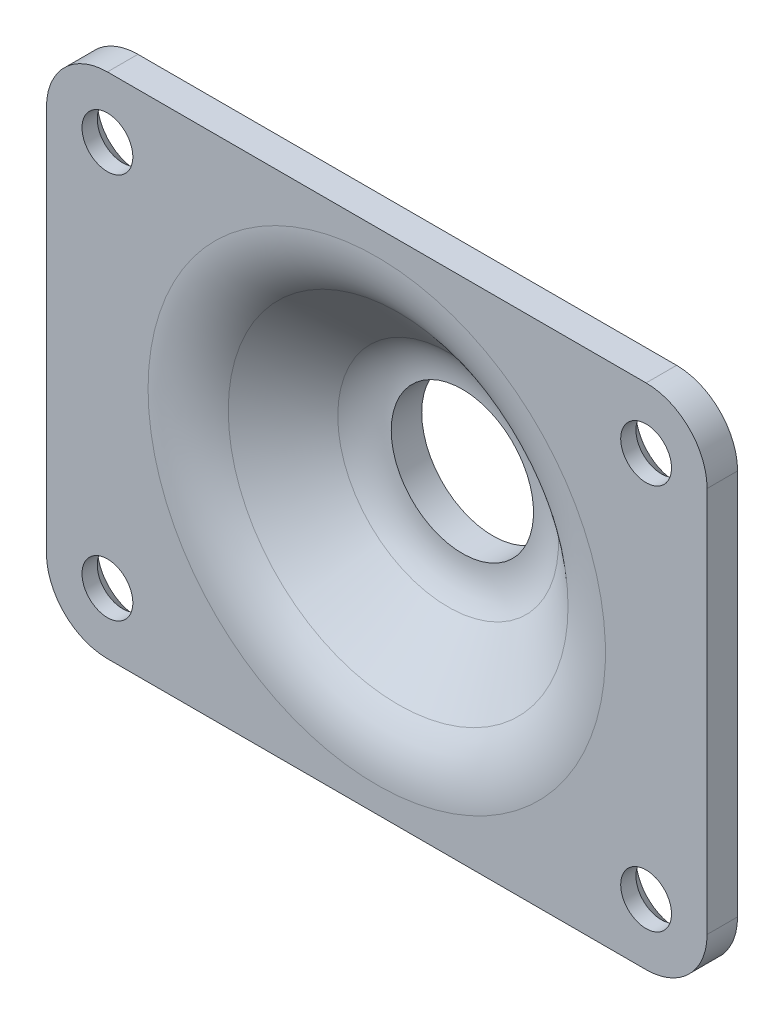
from build123d import *

# Parameters (mm, degrees)
BOSS_EXTRUDE3_START   = -3
SKETCH5_R             = 34.749730026
SKETCH5_R_2           = 22.5
SKETCH5_W             = 65
SKETCH5_H             = 50
BOSS_EXTRUDE3_DEPTH   = 3
SKETCH5_4_OUTSIDE_W   = 91.29
SKETCH5_4_OUTSIDE_H   = 91.29
SKETCH5_4_OUTSIDE_W_2 = 65
SKETCH5_4_OUTSIDE_H_2 = 50
CUT_EXTRUDE2_DEPTH    = 3
CUT_REVOLVE2_START    = 6.924934943
CUT_REVOLVE2_DEPTH    = 3
BOSS_EXTRUDE4_DEPTH   = 3
FILLET1_R             = 6
SKETCH8_R             = 2.5
CUT_EXTRUDE3_DEPTH    = 42.859640811
CHAMFER1_SIZE         = 1.5


with BuildPart() as part:
    # Sketch1 → Revolve1 (revolve)
    with BuildSketch(Plane(origin=(0, 0, 0), x_dir=(1, 0, 0), z_dir=(0, 1, 0)), mode=Mode.PRIVATE) as revolve1_sk:
        with BuildLine():
            Line((22.5, -6.924934943), (32.140333189, -6.924934943))
            Line((32.140333189, -6.924934943), (32.140333189, -9.924934943))
            Line((32.140333189, -9.924934943), (22.5, -9.924934943))
            ThreePointArc((22.5, -9.924934943), (19.42181871, -9.38216853), (16.714911513, -7.819334931))
            Line((16.714911513, -7.819334931), (10.856725658, -2.903733341))
            ThreePointArc((10.856725658, -2.903733341), (9.05212086, -1.861844275), (7, -1.5))
            Line((7, -1.5), (7, 1.5))
            ThreePointArc((7, 1.5), (10.07818129, 0.957233587), (12.785088487, -0.605600012))
            Line((12.785088487, -0.605600012), (18.643274342, -5.521201602))
            ThreePointArc((18.643274342, -5.521201602), (20.44787914, -6.563090668), (22.5, -6.924934943))
        make_face()
        with BuildLine():
            Line((-7, 1.5), (-7, -1.5))
            ThreePointArc((-7, -1.5), (-9.05212086, -1.861844275), (-10.856725658, -2.903733341))
            Line((-10.856725658, -2.903733341), (-16.714911513, -7.819334931))
            ThreePointArc((-16.714911513, -7.819334931), (-19.42181871, -9.38216853), (-22.5, -9.924934943))
            Line((-22.5, -9.924934943), (-34.749730026, -9.924934943))
            Line((-34.749730026, -9.924934943), (-34.749730026, -6.924934943))
            Line((-34.749730026, -6.924934943), (-22.5, -6.924934943))
            ThreePointArc((-22.5, -6.924934943), (-20.44787914, -6.563090668), (-18.643274342, -5.521201602))
            Line((-18.643274342, -5.521201602), (-12.785088487, -0.605600012))
            ThreePointArc((-12.785088487, -0.605600012), (-10.07818129, 0.957233587), (-7, 1.5))
        make_face()
    revolve(revolve1_sk.sketch.rotate(Axis((0, 0, 0), (0, 0, 1)), 180), axis=Axis((0, 0, 0), (0, 0, 1)))

    # Sketch5 → Boss-Extrude3 (add)
    with BuildSketch(Plane.XY.offset(9.924934943).offset(BOSS_EXTRUDE3_START)):
        Circle(SKETCH5_R)
        Circle(SKETCH5_R_2)
        Rectangle(SKETCH5_W, SKETCH5_H)
        Circle(SKETCH5_R_2)
        with BuildLine():
            ThreePointArc((24.135942842, 25), (29.021182623, 19.113207373), (32.5, 12.300151905))
            Line((32.5, 12.300151905), (32.5, 25))
            Line((32.5, 25), (24.135942842, 25))
        make_face()
        with BuildLine():
            ThreePointArc((32.5, -12.300151905), (29.021182623, -19.113207373), (24.135942842, -25))
            Line((24.135942842, -25), (32.5, -25))
            Line((32.5, -25), (32.5, -12.300151905))
        make_face()
        with BuildLine():
            Line((-32.5, -12.300151905), (-32.5, -25))
            Line((-32.5, -25), (-24.135942842, -25))
            ThreePointArc((-24.135942842, -25), (-29.021182623, -19.113207373), (-32.5, -12.300151905))
        make_face()
        with BuildLine():
            Line((-32.5, 25), (-32.5, 12.300151905))
            ThreePointArc((-32.5, 12.300151905), (-29.021182623, 19.113207373), (-24.135942842, 25))
            Line((-24.135942842, 25), (-32.5, 25))
        make_face()
    extrude(amount=BOSS_EXTRUDE3_DEPTH)

    # Sketch5<4> outside → Cut-Extrude2 (cut)
    with BuildSketch(Plane.XY.offset(9.924934943)):
        Rectangle(SKETCH5_4_OUTSIDE_W, SKETCH5_4_OUTSIDE_H)
        Rectangle(SKETCH5_4_OUTSIDE_W_2, SKETCH5_4_OUTSIDE_H_2, mode=Mode.SUBTRACT)
    extrude(amount=-CUT_EXTRUDE2_DEPTH, mode=Mode.SUBTRACT)

    # Cut-Revolve2: read off the stored shape, not the designer's step
    # Cut-Revolve2 outline → Cut-Revolve2 (cut)
    with BuildSketch(Plane.XY.offset(CUT_REVOLVE2_START)):
        with BuildLine():
            Line((32.5, 25), (24.135942842, 25))
            ThreePointArc((24.135942842, 25), (29.021182623, 19.113207373), (32.5, 12.300151905))
            Line((32.5, 12.300151905), (32.5, 25))
        make_face()
        with BuildLine():
            ThreePointArc((-32.5, 12.300151905), (-29.021182623, 19.113207373), (-24.135942842, 25))
            Line((-24.135942842, 25), (-32.5, 25))
            Line((-32.5, 25), (-32.5, 12.300151905))
        make_face()
        with BuildLine():
            Line((32.5, -25), (32.5, -12.300151905))
            ThreePointArc((32.5, -12.300151905), (29.021182623, -19.113207373), (24.135942842, -25))
            Line((24.135942842, -25), (32.5, -25))
        make_face()
        with BuildLine():
            ThreePointArc((-24.135942842, -25), (-29.021182623, -19.113207373), (-32.5, -12.300151905))
            Line((-32.5, -12.300151905), (-32.5, -25))
            Line((-32.5, -25), (-24.135942842, -25))
        make_face()
    extrude(amount=CUT_REVOLVE2_DEPTH, mode=Mode.SUBTRACT)

    # Cut-Revolve2 2 outline → Cut-Revolve2 2 (revolve, cut)
    with BuildSketch(Plane.XZ):
        with BuildLine():
            Line((22.5, 9.924934943), (0, 9.924934943))
            Line((0, 9.924934943), (0, 6.924934943))
            Line((0, 6.924934943), (15.649007114, 6.924934943))
            Line((15.649007114, 6.924934943), (16.714911513, 7.819334931))
            ThreePointArc((16.714911513, 7.819334931), (19.42181871, 9.38216853), (22.5, 9.924934943))
        make_face()
    revolve(axis=Axis((0, 0, 0), (0, 0, 1)), mode=Mode.SUBTRACT)

    # Sketch7 → Boss-Extrude4 (add)
    with BuildSketch(Plane(origin=(0, 0, 6.924934943), x_dir=(-1, 0, 0), z_dir=(0, 0, -1))):
        with BuildLine():
            Line((-32.5, 25), (-32.5, 12.300151905))
            ThreePointArc((-32.5, 12.300151905), (-29.021182623, 19.113207373), (-24.135942842, 25))
            Line((-24.135942842, 25), (-32.5, 25))
        make_face()
        with BuildLine():
            Line((-32.5, -12.300151905), (-32.5, -25))
            Line((-32.5, -25), (-24.135942842, -25))
            ThreePointArc((-24.135942842, -25), (-29.021182623, -19.113207373), (-32.5, -12.300151905))
        make_face()
        with BuildLine():
            ThreePointArc((32.5, -12.300151905), (29.021182623, -19.113207373), (24.135942842, -25))
            Line((24.135942842, -25), (32.5, -25))
            Line((32.5, -25), (32.5, -12.300151905))
        make_face()
        with BuildLine():
            ThreePointArc((24.135942842, 25), (29.021182623, 19.113207373), (32.5, 12.300151905))
            Line((32.5, 12.300151905), (32.5, 25))
            Line((32.5, 25), (24.135942842, 25))
        make_face()
    extrude(amount=-BOSS_EXTRUDE4_DEPTH)

    # Fillet1
    fillet1_edges = [part.edges().sort_by_distance(p)[0] for p in [
        (32.5, 25, 8.424934943),
        (32.5, -25, 8.424934943),
        (-32.5, -25, 8.424934943),
        (-32.5, 25, 8.424934943),
    ]]
    fillet(fillet1_edges, radius=FILLET1_R)

    # Sketch8 → Cut-Extrude3 (cut, through all)
    with BuildSketch(Plane(origin=(0, 0, 6.924934943), x_dir=(-1, 0, 0), z_dir=(0, 0, -1))):
        with Locations((-26.5, -19)):
            Circle(SKETCH8_R)
        with Locations((26.5, -19)):
            Circle(SKETCH8_R)
        with Locations((26.5, 19)):
            Circle(SKETCH8_R)
        with Locations((-26.5, 19)):
            Circle(SKETCH8_R)
    extrude(amount=-CUT_EXTRUDE3_DEPTH, mode=Mode.SUBTRACT)

    # Chamfer1
    chamfer1_edges = [part.edges().sort_by_distance(p)[0] for p in [
        (29, 19, 6.924934943),
        (-24, 19, 6.924934943),
        (-24, -19, 6.924934943),
        (29, -19, 6.924934943),
    ]]
    chamfer(chamfer1_edges, length=CHAMFER1_SIZE)


solid = part.part
